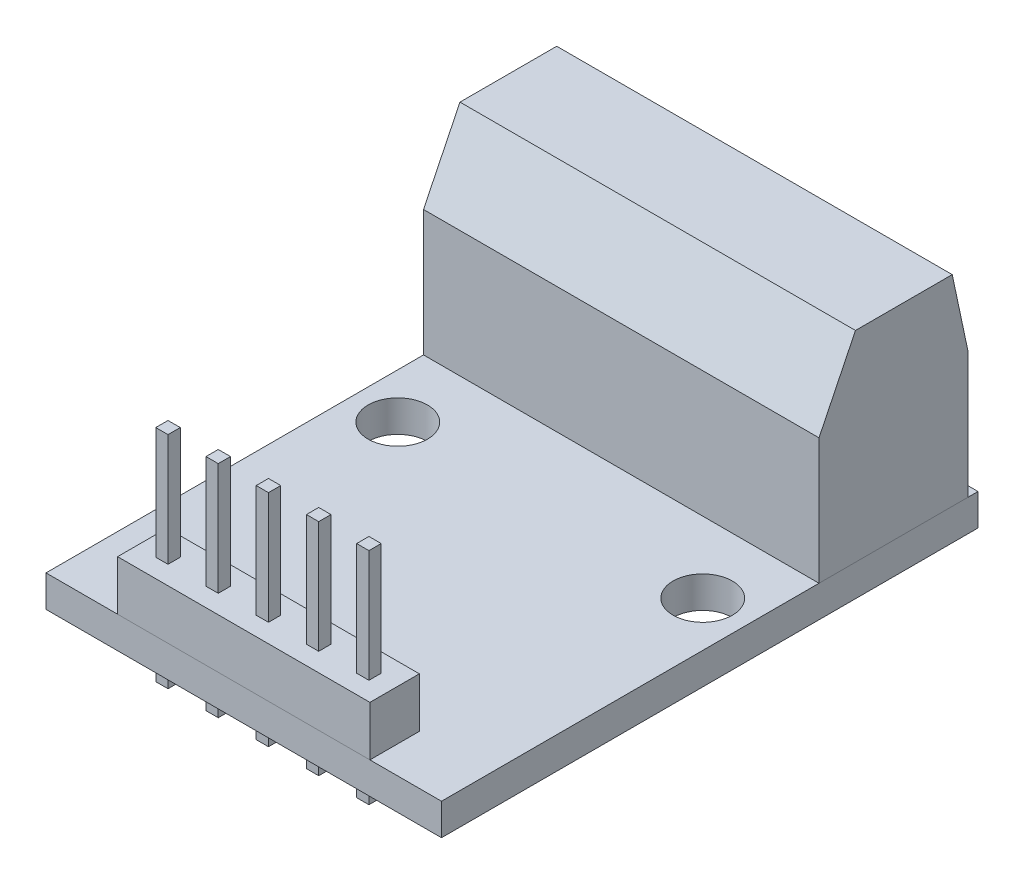
from build123d import *

# Parameters (mm, degrees)
SKETCH1_W                  = 20
SKETCH1_H                  = 27.13
BOSS_EXTRUDE1_DEPTH        = 1.6
SKETCH2_W                  = 12.76
SKETCH2_H                  = 2.5
BOSS_EXTRUDE2_DEPTH        = 2.52
BOSS_EXTRUDE3_DEPTH        = 5.68
BOSS_EXTRUDE3_DEPTH_BACK   = 5.45
SKETCH3_W                  = 0.62
SKETCH3_H                  = 0.62
BOSS_EXTRUDE3_2_DEPTH      = 5.68
BOSS_EXTRUDE3_2_DEPTH_BACK = 5.45
BOSS_EXTRUDE3_3_DEPTH      = 5.68
BOSS_EXTRUDE3_3_DEPTH_BACK = 5.45
BOSS_EXTRUDE3_4_DEPTH      = 5.68
BOSS_EXTRUDE3_4_DEPTH_BACK = 5.45
BOSS_EXTRUDE3_5_DEPTH      = 5.68
BOSS_EXTRUDE3_5_DEPTH_BACK = 5.45
SKETCH4_W                  = 20
SKETCH4_H                  = 7.54
BOSS_EXTRUDE4_DEPTH        = 10.15
SKETCH5_W                  = 4.1
SKETCH5_H                  = 5.6
CUT_EXTRUDE1_DEPTH         = 4
CHAMFER1_SIZE              = 0.803463803
CHAMFER1_SIZE_2            = 3.78
CHAMFER2_SIZE              = 3.78
CHAMFER2_SIZE2             = 1.843629185
SKETCH6_R                  = 1.5
CUT_EXTRUDE2_DEPTH         = 20.673121893


with BuildPart() as part:
    # Sketch1 → Boss-Extrude1 (new body)
    with BuildSketch(Plane(origin=(0, 0, 0), x_dir=(1, 0, 0), z_dir=(0, 1, 0))):
        Rectangle(SKETCH1_W, SKETCH1_H)
    extrude(amount=BOSS_EXTRUDE1_DEPTH)

    # Sketch6 → Cut-Extrude2 (cut, through all)
    with BuildSketch(Plane(origin=(0, 1.6, 0), x_dir=(1, 0, 0), z_dir=(0, 1, 0))):
        with Locations(Location((-7.71, 1.935, 0), (0, 0, 270))):
            Circle(SKETCH6_R)
        with Locations(Location((7.71, 1.935, 0), (0, 0, 270))):
            Circle(SKETCH6_R)
    extrude(amount=-CUT_EXTRUDE2_DEPTH, mode=Mode.SUBTRACT)


with BuildPart() as body_2:
    # Sketch2 → Boss-Extrude2 (new body)
    with BuildSketch(Plane(origin=(0, 1.6, 0), x_dir=(1, 0, 0), z_dir=(0, 1, 0))):
        with Locations((0, -12.315)):
            Rectangle(SKETCH2_W, SKETCH2_H)
    extrude(amount=BOSS_EXTRUDE2_DEPTH)


with BuildPart() as body_3:
    # Sketch3 → Boss-Extrude3 (new, two sides: drawn at the far end of the back side and taken through both)
    with BuildSketch(Plane(origin=(0, 4.12, 0), x_dir=(1, 0, 0), z_dir=(0, 1, 0)).offset(-BOSS_EXTRUDE3_DEPTH_BACK)):
        with Locations((-5.08, -12.315)):
            Rectangle(SKETCH3_W, SKETCH3_H)
    extrude(amount=BOSS_EXTRUDE3_DEPTH + BOSS_EXTRUDE3_DEPTH_BACK)


with BuildPart() as body_4:
    # Sketch3 → Boss-Extrude3 2 (new, two sides: drawn at the far end of the back side and taken through both)
    with BuildSketch(Plane(origin=(0, 4.12, 0), x_dir=(1, 0, 0), z_dir=(0, 1, 0)).offset(-BOSS_EXTRUDE3_2_DEPTH_BACK)):
        with Locations((-2.54, -12.315)):
            Rectangle(SKETCH3_W, SKETCH3_H)
    extrude(amount=BOSS_EXTRUDE3_2_DEPTH + BOSS_EXTRUDE3_2_DEPTH_BACK)


with BuildPart() as body_5:
    # Sketch3 → Boss-Extrude3 3 (new, two sides: drawn at the far end of the back side and taken through both)
    with BuildSketch(Plane(origin=(0, 4.12, 0), x_dir=(1, 0, 0), z_dir=(0, 1, 0)).offset(-BOSS_EXTRUDE3_3_DEPTH_BACK)):
        with Locations((0, -12.315)):
            Rectangle(SKETCH3_W, SKETCH3_H)
    extrude(amount=BOSS_EXTRUDE3_3_DEPTH + BOSS_EXTRUDE3_3_DEPTH_BACK)


with BuildPart() as body_6:
    # Sketch3 → Boss-Extrude3 4 (new, two sides: drawn at the far end of the back side and taken through both)
    with BuildSketch(Plane(origin=(0, 4.12, 0), x_dir=(1, 0, 0), z_dir=(0, 1, 0)).offset(-BOSS_EXTRUDE3_4_DEPTH_BACK)):
        with Locations((2.54, -12.315)):
            Rectangle(SKETCH3_W, SKETCH3_H)
    extrude(amount=BOSS_EXTRUDE3_4_DEPTH + BOSS_EXTRUDE3_4_DEPTH_BACK)


with BuildPart() as body_7:
    # Sketch3 → Boss-Extrude3 5 (new, two sides: drawn at the far end of the back side and taken through both)
    with BuildSketch(Plane(origin=(0, 4.12, 0), x_dir=(1, 0, 0), z_dir=(0, 1, 0)).offset(-BOSS_EXTRUDE3_5_DEPTH_BACK)):
        with Locations((5.08, -12.315)):
            Rectangle(SKETCH3_W, SKETCH3_H)
    extrude(amount=BOSS_EXTRUDE3_5_DEPTH + BOSS_EXTRUDE3_5_DEPTH_BACK)


with BuildPart() as body_8:
    # Sketch4 → Boss-Extrude4 (new body)
    with BuildSketch(Plane(origin=(0, 1.6, 0), x_dir=(1, 0, 0), z_dir=(0, 1, 0))):
        with Locations((0, 9.295)):
            Rectangle(SKETCH4_W, SKETCH4_H)
    extrude(amount=BOSS_EXTRUDE4_DEPTH)

    # Sketch5 → Cut-Extrude1 (cut)
    with BuildSketch(Plane(origin=(0, 0, -13.065), x_dir=(-1, 0, 0), z_dir=(0, 0, -1))):
        with Locations((-7.23, 5.17)):
            Rectangle(SKETCH5_W, SKETCH5_H)
        with Locations((-2.41, 5.17)):
            Rectangle(SKETCH5_W, SKETCH5_H)
        with Locations((2.41, 5.17)):
            Rectangle(SKETCH5_W, SKETCH5_H)
        with Locations((7.23, 5.17)):
            Rectangle(SKETCH5_W, SKETCH5_H)
    extrude(amount=-CUT_EXTRUDE1_DEPTH, mode=Mode.SUBTRACT)

    # Chamfer1
    # the kernel refuses this chamfer: 3.78, 0.803463803 mm, written as the material it takes off along each edge
    with BuildSketch(Plane(origin=(-19.820054281, 11.75, -13.065), x_dir=(0, 0.1744265095150599, 0.9846701949274146), z_dir=(1, 0, 0))) as chamfer1_piece_1:
        Polygon((CHAMFER1_SIZE * 0.984670195066, CHAMFER1_SIZE * 0.17442650954), (-CHAMFER1_SIZE_2 * 0.174426509515, CHAMFER1_SIZE_2 * 0.984670194927), (0, 0), align=None)
    extrude(amount=39.640108563, mode=Mode.SUBTRACT)

    # Chamfer2
    chamfer2_edges = [body_8.edges().sort_by_distance(p)[0] for p in [
        (0, 11.75, -5.525),
    ]]
    chamfer2_side = [body_8.faces().sort_by_distance(p)[0] for p in [
        (0, 6.675, -5.525),
    ]]
    chamfer(chamfer2_edges, length=CHAMFER2_SIZE, length2=CHAMFER2_SIZE2, reference=chamfer2_side[0])


solid = Compound([part.part, body_2.part, body_3.part, body_4.part, body_5.part, body_6.part, body_7.part, body_8.part])
